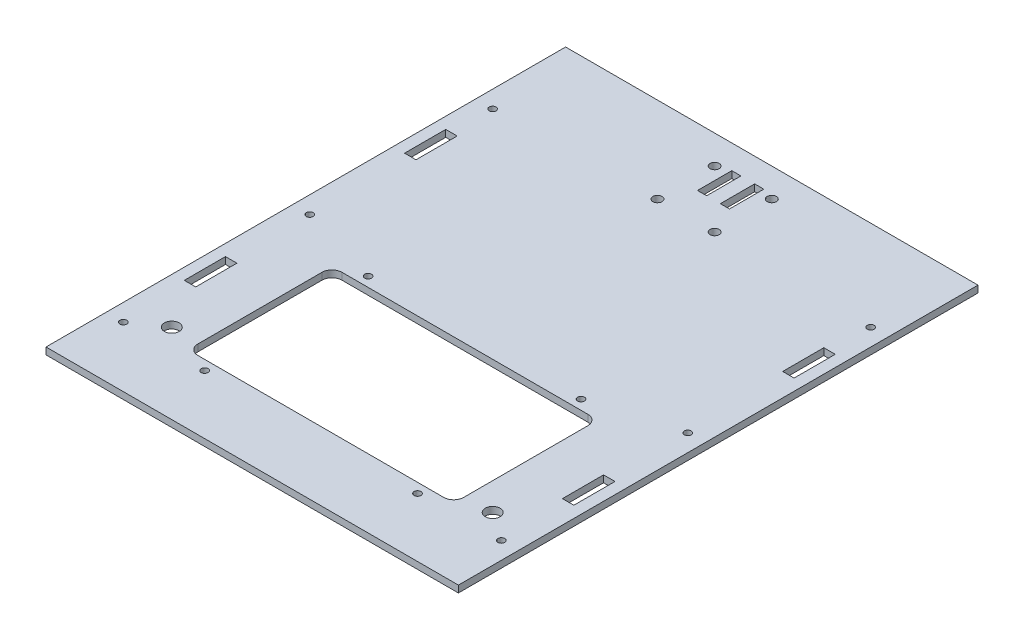
from build123d import *

# Parameters (mm, degrees)
SCHIZZO1_W                   = 180.34
SCHIZZO1_H                   = 227.22
ESTRUSIONE_ESTRUSIONE1_DEPTH = 3
SCHIZZO2_R                   = 1.5
SCHIZZO2_R_2                 = 3.25
SCHIZZO2_R_3                 = 2
SCHIZZO2_W                   = 5
SCHIZZO2_H                   = 18
SCHIZZO2_W_2                 = 4
SCHIZZO2_H_2                 = 15
TAGLIO_ESTRUSIONE1_DEPTH     = 146.075363174
SCHIZZO3_R                   = 1.5
TAGLIO_ESTRUSIONE5_DEPTH     = 146.075363174


with BuildPart() as part:
    # Schizzo1 → Estrusione-Estrusione1 (new body)
    with BuildSketch(Plane(origin=(0, 0, 0), x_dir=(1, 0, 0), z_dir=(0, 1, 0))):
        Rectangle(SCHIZZO1_W, SCHIZZO1_H)
    extrude(amount=ESTRUSIONE_ESTRUSIONE1_DEPTH)

    # Schizzo2 → Taglio-Estrusione1 (cut, through all)
    with BuildSketch(Plane(origin=(0, 0, 0), x_dir=(1, 0, 0), z_dir=(0, 1, 0))):
        with Locations((-82.67, -5.81)):
            Circle(SCHIZZO2_R)
        with Locations((-82.67, -87.31)):
            Circle(SCHIZZO2_R)
        with Locations((-82.67, 74.19)):
            Circle(SCHIZZO2_R)
        with Locations((82.67, -87.31)):
            Circle(SCHIZZO2_R)
        with Locations((82.67, -5.81)):
            Circle(SCHIZZO2_R)
        with Locations((82.67, 74.19)):
            Circle(SCHIZZO2_R)
        with Locations((-70.17, -78.61)):
            Circle(SCHIZZO2_R_2)
        with Locations((70.17, -78.61)):
            Circle(SCHIZZO2_R_2)
        with Locations((-12.5, 101.11)):
            Circle(SCHIZZO2_R_3)
        with Locations((-12.5, 76.11)):
            Circle(SCHIZZO2_R_3)
        with Locations((12.5, 76.11)):
            Circle(SCHIZZO2_R_3)
        with Locations((12.5, 101.11)):
            Circle(SCHIZZO2_R_3)
        with Locations((82.67, -49.13)):
            Rectangle(SCHIZZO2_W, SCHIZZO2_H)
        with Locations((-82.67, -49.13)):
            Rectangle(SCHIZZO2_W, SCHIZZO2_H)
        with Locations((-82.67, 47.19)):
            Rectangle(SCHIZZO2_W, SCHIZZO2_H)
        with Locations((82.67, 47.19)):
            Rectangle(SCHIZZO2_W, SCHIZZO2_H)
        with Locations((5, 95.61)):
            Rectangle(SCHIZZO2_W_2, SCHIZZO2_H_2)
        with Locations((-5, 95.61)):
            Rectangle(SCHIZZO2_W_2, SCHIZZO2_H_2)
    extrude(amount=TAGLIO_ESTRUSIONE1_DEPTH, mode=Mode.SUBTRACT)

    # Schizzo3 → Taglio-Estrusione5 (cut, through all)
    with BuildSketch(Plane(origin=(0, 0, 0), x_dir=(1, 0, 0), z_dir=(0, 1, 0))):
        with Locations((-46.55, -16.36)):
            Circle(SCHIZZO3_R)
        with Locations((-46.55, -87.86)):
            Circle(SCHIZZO3_R)
        with Locations((46.55, -16.36)):
            Circle(SCHIZZO3_R)
        with Locations((46.55, -87.86)):
            Circle(SCHIZZO3_R)
        with BuildLine():
            Line((-53.765, -20.61), (53.765, -20.61))
            ThreePointArc((53.765, -20.61), (56.840914498, -21.884085502), (58.115, -24.96))
            Line((58.115, -24.96), (58.115, -79.26))
            ThreePointArc((58.115, -79.26), (56.840914498, -82.335914498), (53.765, -83.61))
            Line((53.765, -83.61), (-53.765, -83.61))
            ThreePointArc((-53.765, -83.61), (-56.840914498, -82.335914498), (-58.115, -79.26))
            Line((-58.115, -79.26), (-58.115, -24.96))
            ThreePointArc((-58.115, -24.96), (-56.840914498, -21.884085502), (-53.765, -20.61))
        make_face()
    extrude(amount=TAGLIO_ESTRUSIONE5_DEPTH, mode=Mode.SUBTRACT)


solid = part.part
